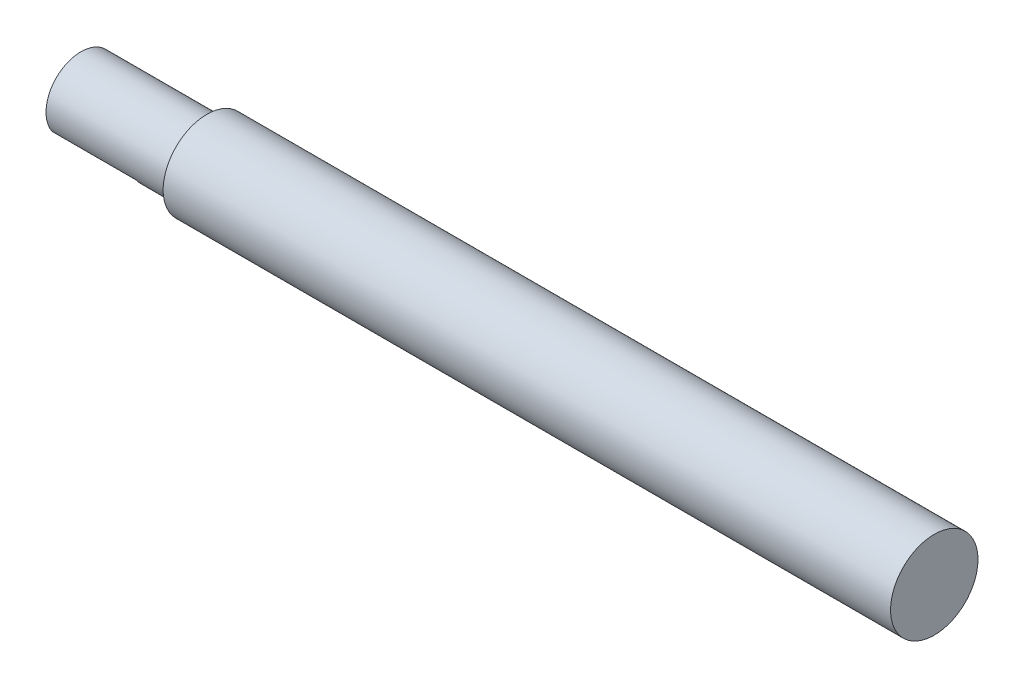
from build123d import *

# Parameters (mm, degrees)
SKETCH2_R           = 3.96875
BOSS_EXTRUDE1_DEPTH = 66.04
SKETCH3_R           = 3.175
BOSS_EXTRUDE2_DEPTH = 11.43
CUT_EXTRUDE1_DEPTH  = 7.62


with BuildPart() as part:
    # Sketch2 → Boss-Extrude1 (new body)
    with BuildSketch(Plane(origin=(0, 0, 0), x_dir=(0, 0, -1), z_dir=(1, 0, 0))):
        Circle(SKETCH2_R)
    extrude(amount=BOSS_EXTRUDE1_DEPTH)

    # Sketch3 → Boss-Extrude2 (add)
    with BuildSketch(Plane(origin=(0, 0, 0), x_dir=(0, 0, -1), z_dir=(1, 0, 0))):
        Circle(SKETCH3_R)
    extrude(amount=-BOSS_EXTRUDE2_DEPTH)

    # Sketch4 → Cut-Extrude1 (cut)
    with BuildSketch(Plane.ZY.offset(11.43)):
        Polygon((-2.630464028, -1.778), (2.630464028, -1.778), (3.028427561, -2.61948228), (1.395900731, -3.652283599), (-4.099286663, -3.460964559), align=None)
    extrude(amount=-CUT_EXTRUDE1_DEPTH, mode=Mode.SUBTRACT)


solid = part.part
